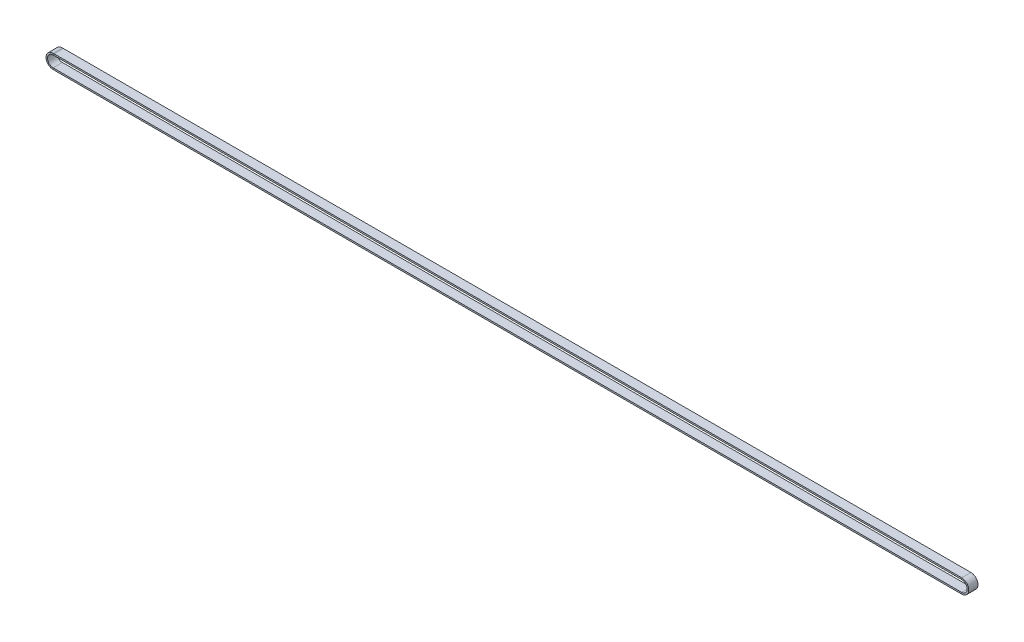
from build123d import *

# Parameters (mm, degrees)
SKETCH3_W = 9
SKETCH3_H = 1.5


with BuildPart() as part:
    # Sweep1: sweep along a path in Sketch2
    with BuildLine(Plane.XY.offset(-26.233366658)) as sweep1_path:
        Line((-1, -57.890227813), (883.520637828, -57.890227813))
        ThreePointArc((883.520637828, -57.890227813), (890.420637828, -64.790227813), (883.520637828, -71.690227813))
        Line((883.520637828, -71.690227813), (-1, -71.690227813))
        ThreePointArc((-1, -71.690227813), (-7.9, -64.790227813), (-1, -57.890227813))
    # Sketch3 → Sweep1 (sweep)
    with BuildSketch(Plane(origin=(0, 0, 0), x_dir=(0, 0, -1), z_dir=(1, 0, 0))):
        with Locations((21.733366658, -58.640227813)):
            Rectangle(SKETCH3_W, SKETCH3_H)
    sweep(path=sweep1_path.line)


solid = part.part
